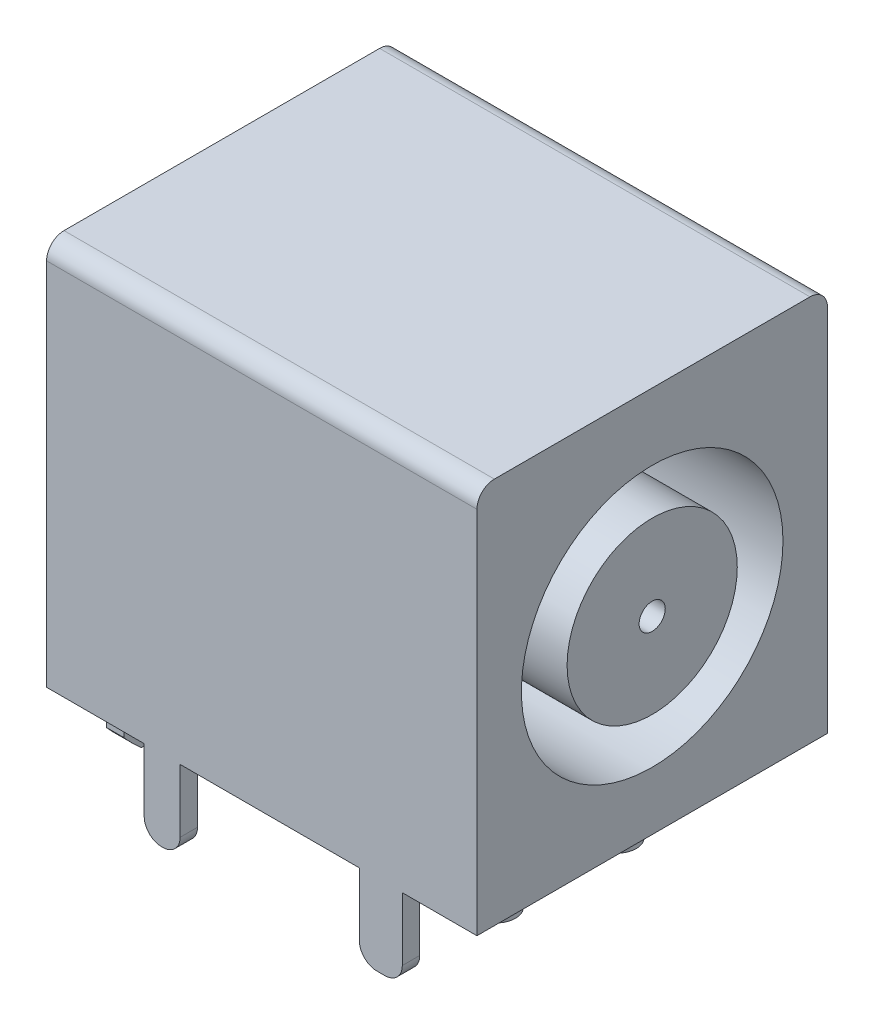
from build123d import *

# Parameters (mm, degrees)
SKETCH1_W           = 12.34
SKETCH1_H           = 10.05
BOSS_EXTRUDE1_DEPTH = 11.09
SKETCH2_R           = 3.75
CUT_EXTRUDE1_DEPTH  = 5
SKETCH4_R           = 2.44
BOSS_EXTRUDE2_DEPTH = 5
SKETCH6_R           = 0.375
CUT_EXTRUDE2_DEPTH  = 8
SKETCH13_R          = 0.555
SKETCH13_W          = 1.23
SKETCH13_H          = 0.5
SKETCH13_W_2        = 0.5
SKETCH13_H_2        = 1.2
SKETCH13_W_3        = 1.03
SKETCH13_W_4        = 0.455661697
SKETCH13_W_5        = 0.46
SKETCH13_W_6        = 0.68
SKETCH13_H_3        = 0.37
BOSS_EXTRUDE3_DEPTH = 2.31
FILLET2_R           = 0.5
FILLET3_R           = 0.5
FILLET4_SIZE        = 0.5


with BuildPart() as part:
    # Sketch1 → Boss-Extrude1 (new body)
    with BuildSketch(Plane(origin=(0, 0, 0), x_dir=(1, 0, 0), z_dir=(0, 1, 0))):
        Rectangle(SKETCH1_W, SKETCH1_H)
    extrude(amount=BOSS_EXTRUDE1_DEPTH)

    # Sketch2 → Cut-Extrude1 (cut)
    with BuildSketch(Plane(origin=(6.17, 0, 0), x_dir=(0, 0, -1), z_dir=(1, 0, 0))):
        with Locations((0, 5.42)):
            Circle(SKETCH2_R)
    extrude(amount=-CUT_EXTRUDE1_DEPTH, mode=Mode.SUBTRACT)

    # Sketch4 → Boss-Extrude2 (add)
    with BuildSketch(Plane(origin=(1.17, 0, 0), x_dir=(0, 0, -1), z_dir=(1, 0, 0))):
        with Locations(Location((0, 5.42, 0), (0, 0, 180))):
            Circle(SKETCH4_R)
    extrude(amount=BOSS_EXTRUDE2_DEPTH)

    # Sketch6 → Cut-Extrude2 (cut)
    with BuildSketch(Plane(origin=(6.17, 0, 0), x_dir=(0, 0, -1), z_dir=(1, 0, 0))):
        with Locations((0, 5.42)):
            Circle(SKETCH6_R)
    extrude(amount=-CUT_EXTRUDE2_DEPTH, mode=Mode.SUBTRACT)

    # Sketch13 → Boss-Extrude3 (add)
    with BuildSketch(Plane.XZ):
        with Locations(Location((3.425, 1.73, 0), (0, 0, 90))):
            Circle(SKETCH13_R)
        with Locations(Location((3.425, -1.73, 0), (0, 0, 90))):
            Circle(SKETCH13_R)
        with Locations((3.415, 4.775)):
            Rectangle(SKETCH13_W, SKETCH13_H)
        with Locations((-5.87, -2.755)):
            Rectangle(SKETCH13_W_2, SKETCH13_H_2)
        with Locations((-2.855, 4.775)):
            Rectangle(SKETCH13_W_3, SKETCH13_H)
        with Locations((-5.87, 2.755)):
            Rectangle(SKETCH13_W_2, SKETCH13_H_2)
        with Locations((-3.042169152, 0)):
            Rectangle(SKETCH13_W_4, SKETCH13_H_2)
        with Locations((0.955661697, 0)):
            Rectangle(SKETCH13_W_5, SKETCH13_H_2)
        with Locations((-2.855, -4.775)):
            Rectangle(SKETCH13_W_3, SKETCH13_H)
        with Locations((3.415, -4.775)):
            Rectangle(SKETCH13_W, SKETCH13_H)
        with Locations((-5.83, 0)):
            Rectangle(SKETCH13_W_6, SKETCH13_H_3)
    extrude(amount=BOSS_EXTRUDE3_DEPTH)

    # Fillet2
    fillet2_edges = [part.edges().sort_by_distance(p)[0] for p in [
        (-2.34, -2.31, -4.775),
        (-3.37, -2.31, -4.775),
        (4.03, -2.31, -4.775),
        (2.8, -2.31, -4.775),
        (4.03, -2.31, 4.775),
        (2.8, -2.31, 4.775),
        (-3.37, -2.31, 4.775),
        (-2.34, -2.31, 4.775),
    ]]
    fillet(fillet2_edges, radius=FILLET2_R)

    # Fillet3
    fillet3_edges = [part.edges().sort_by_distance(p)[0] for p in [
        (0, 11.09, 5.025),
        (0, 11.09, -5.025),
    ]]
    fillet(fillet3_edges, radius=FILLET3_R)

    # Fillet4
    # a fillet whose section is not a circle: 0.5 mm, written as the material it takes off along each edge
    with BuildSketch(Plane(origin=(2.435661697, -2.31, -0.6), x_dir=(0, 1, 0), z_dir=(-1, 0, 0)), Plane(origin=(-0.524338303, -2.31, 0.6), x_dir=(0, 1, 0), z_dir=(1, 0, 0))) as fillet4_piece_1:
        with BuildLine():
            Bezier((FILLET4_SIZE, 0), (0, 0), (0, -FILLET4_SIZE), weights=[1, 0.035355339, 1])
            Line((0, -FILLET4_SIZE), (0, 0))
            Line((0, 0), (FILLET4_SIZE, 0))
        make_face()
    extrude(amount=2.96, mode=Mode.SUBTRACT)
    with BuildSketch(Plane(origin=(-1.564338303, -2.31, -0.6), x_dir=(0, 1, 0), z_dir=(-1, 0, 0)), Plane(origin=(-4.52, -2.31, 0.6), x_dir=(0, 1, 0), z_dir=(1, 0, 0))) as fillet4_piece_2:
        with BuildLine():
            Bezier((FILLET4_SIZE, 0), (0, 0), (0, -FILLET4_SIZE), weights=[1, 0.035355339, 1])
            Line((0, -FILLET4_SIZE), (0, 0))
            Line((0, 0), (FILLET4_SIZE, 0))
        make_face()
    extrude(amount=2.955661697, mode=Mode.SUBTRACT)
    with BuildSketch(Plane(origin=(-7.37, -2.31, -3.355), x_dir=(0, 1, 0), z_dir=(1, 0, 0)), Plane(origin=(-4.37, -2.31, -2.155), x_dir=(0, 1, 0), z_dir=(-1, 0, 0))) as fillet4_piece_3:
        with BuildLine():
            Bezier((FILLET4_SIZE, 0), (0, 0), (0, FILLET4_SIZE), weights=[1, 0.035355339, 1])
            Line((0, FILLET4_SIZE), (0, 0))
            Line((0, 0), (FILLET4_SIZE, 0))
        make_face()
    extrude(amount=3, mode=Mode.SUBTRACT)
    with BuildSketch(Plane(origin=(-4.37, -2.31, 2.155), x_dir=(0, 1, 0), z_dir=(-1, 0, 0)), Plane(origin=(-7.37, -2.31, 3.355), x_dir=(0, 1, 0), z_dir=(1, 0, 0))) as fillet4_piece_4:
        with BuildLine():
            Bezier((FILLET4_SIZE, 0), (0, 0), (0, -FILLET4_SIZE), weights=[1, 0.035355339, 1])
            Line((0, -FILLET4_SIZE), (0, 0))
            Line((0, 0), (FILLET4_SIZE, 0))
        make_face()
    extrude(amount=3, mode=Mode.SUBTRACT)


solid = part.part
